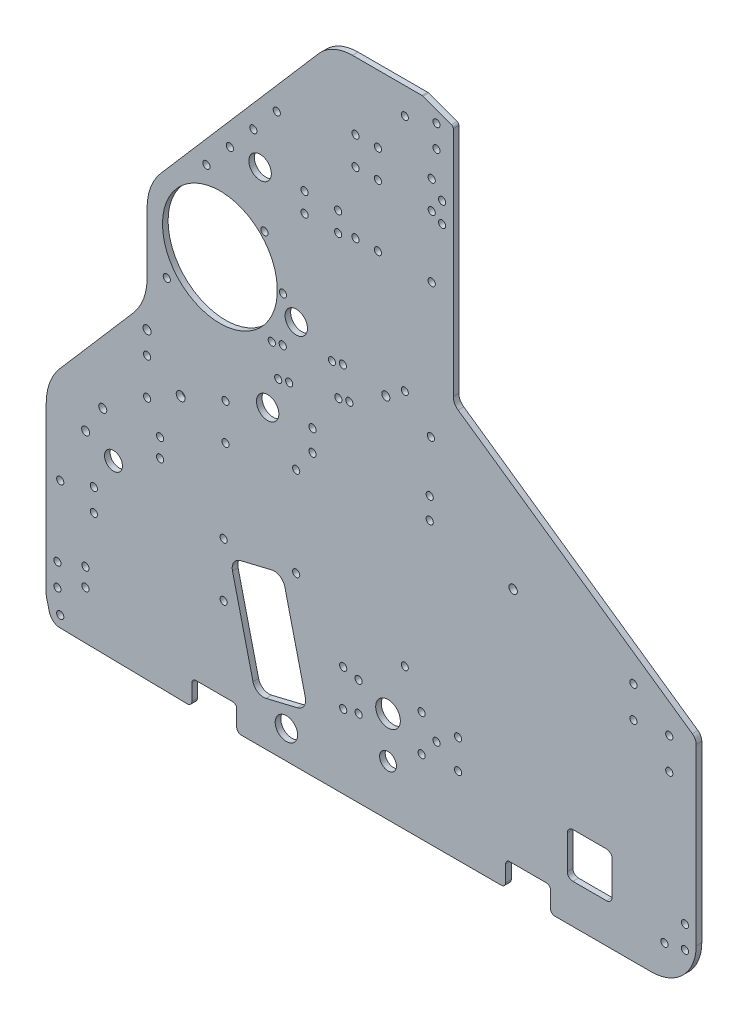
from build123d import *

# Parameters (mm, degrees)
SKETCH1_R           = 2.032
SKETCH1_R_2         = 5.08
SKETCH1_R_3         = 2.54
SKETCH1_R_4         = 6.35
SKETCH1_R_5         = 2
BOSS_EXTRUDE1_DEPTH = 3.175
FILLET1_R           = 2.286
FILLET2_R           = 6.35
SKETCH2_R           = 2.032
CUT_EXTRUDE1_DEPTH  = 505.524983177
FILLET3_R           = 1.5875
SKETCH3_R           = 6.35
SKETCH3_R_2         = 2.032
SKETCH3_R_3         = 2.286
CUT_EXTRUDE2_DEPTH  = 505.524983177
SKETCH4_R           = 2.032
SKETCH4_R_2         = 6.985
SKETCH4_R_3         = 4.7625
CUT_EXTRUDE3_DEPTH  = 505.524983177
SKETCH5_R           = 32.54375
SKETCH5_R_2         = 6.35
SKETCH5_R_3         = 2.39
CUT_EXTRUDE5_DEPTH  = 505.524983177
FILLET4_R           = 31.75
CUT_EXTRUDE6_DEPTH  = 505.524983177
FILLET5_R           = 25.4
SKETCH8_R           = 2.032000002
SKETCH8_R_2         = 2.031999999
SKETCH8_R_3         = 2.031999998
CUT_EXTRUDE7_DEPTH  = 505.524983177
SKETCH10_R          = 2.032
CUT_EXTRUDE8_DEPTH  = 505.524983177
SKETCH11_RX         = 2.032
SKETCH11_RY         = 2.031999502
CUT_EXTRUDE9_DEPTH  = 505.524983177
SKETCH12_R          = 2.032
CUT_EXTRUDE10_DEPTH = 505.524983319
SKETCH14_R          = 6.375981846
CUT_EXTRUDE11_DEPTH = 505.524983319
SKETCH15_R          = 2.286
SKETCH15_R_2        = 2.159
CUT_EXTRUDE12_DEPTH = 505.524983319
FILLET7_R           = 5.08
FILLET8_R           = 2.54
SKETCH17_R          = 2.032
CUT_EXTRUDE13_DEPTH = 505.524983319
FILLET9_R           = 25.4


with BuildPart() as part:
    # Sketch1 → Boss-Extrude1 (new body)
    with BuildSketch(Plane.XY):
        with BuildLine():
            Line((7.829508682, -19.049081656), (82.55, -20.32))
            Line((82.55, -20.32), (82.55, -6.35))
            Line((82.55, -6.35), (107.95, -6.35))
            Line((107.95, -6.35), (107.95, -20.32))
            Line((107.95, -20.32), (260.35, -20.32))
            Line((260.35, -20.32), (260.35, -6.35))
            Line((260.35, -6.35), (285.75, -6.35))
            Line((285.75, -6.35), (285.75, -20.32))
            Line((285.75, -20.32), (368.3, -20.32))
            Line((368.3, -20.32), (368.3, 106.68))
            Line((368.3, 106.68), (230.66375, 202.565))
            Line((230.66375, 202.565), (230.66375, 338.455))
            Line((230.66375, 338.455), (213.19998, 344.805))
            Line((213.19998, 344.805), (203.2, 344.805))
            Line((203.2, 344.805), (161.925, 344.805))
            Line((161.925, 344.805), (52.720122664, 218.469945827))
            ThreePointArc((52.720122664, 218.469945827), (52.803835479, 218.142145922), (52.832, 217.805))
            ThreePointArc((52.832, 217.805), (52.095493096, 216.239521914), (50.419872403, 215.808871996))
            Line((50.419872403, 215.808871996), (0, 157.48))
            Line((0, 157.48), (0, 0))
            Line((0, 0), (0, -6.35))
            ThreePointArc((0, -6.35), (0.047577015, -7.125863724), (0.189595124, -7.890101219))
            Line((0.189595124, -7.890101219), (1.777095124, -14.240101219))
            ThreePointArc((1.777095124, -14.240101219), (3.987212552, -17.671692778), (7.829508682, -19.049081656))
        make_face()
        with Locations((7.9375, -12.7)):
            Circle(SKETCH1_R, mode=Mode.SUBTRACT)
        with Locations((6.35, 0)):
            Circle(SKETCH1_R, mode=Mode.SUBTRACT)
        with Locations((6.35, 12.7)):
            Circle(SKETCH1_R, mode=Mode.SUBTRACT)
        with Locations((38.1, 78.105)):
            Circle(SKETCH1_R_2, mode=Mode.SUBTRACT)
        with Locations((57.15, 118.58625)):
            Circle(SKETCH1_R, mode=Mode.SUBTRACT)
        with Locations((57.15, 139.22375)):
            Circle(SKETCH1_R, mode=Mode.SUBTRACT)
        with Locations((76.2, 128.905)):
            Circle(SKETCH1_R_3, mode=Mode.SUBTRACT)
        with Locations((101.6, 118.58625)):
            Circle(SKETCH1_R, mode=Mode.SUBTRACT)
        with Locations((101.6, 139.22375)):
            Circle(SKETCH1_R, mode=Mode.SUBTRACT)
        with Locations((125.468192568, 147.91106164)):
            Circle(SKETCH1_R_4, mode=Mode.SUBTRACT)
        with Locations((203.2, 59.805)):
            Circle(SKETCH1_R_5, mode=Mode.SUBTRACT)
        with Locations((350.339487758, -2.359487758)):
            Circle(SKETCH1_R, mode=Mode.SUBTRACT)
        with Locations((361.95, 0)):
            Circle(SKETCH1_R, mode=Mode.SUBTRACT)
        with Locations((361.95, 12.7)):
            Circle(SKETCH1_R, mode=Mode.SUBTRACT)
        with Locations((353.06, 82.955052336)):
            Circle(SKETCH1_R, mode=Mode.SUBTRACT)
        with Locations((332.74, 98.195052336)):
            Circle(SKETCH1_R, mode=Mode.SUBTRACT)
        with Locations((332.74, 115.975052336)):
            Circle(SKETCH1_R, mode=Mode.SUBTRACT)
        with Locations((353.06, 100.735052336)):
            Circle(SKETCH1_R, mode=Mode.SUBTRACT)
        with Locations((68.326, 182.923674932)):
            Circle(SKETCH1_R, mode=Mode.SUBTRACT)
        with Locations((76.2, 217.805)):
            Circle(SKETCH1_R, mode=Mode.SUBTRACT)
        with Locations((90.779500502, 249.682)):
            Circle(SKETCH1_R, mode=Mode.SUBTRACT)
        with Locations((104.067838673, 265.054783374)):
            Circle(SKETCH1_R, mode=Mode.SUBTRACT)
        with Locations((117.356176844, 280.427566748)):
            Circle(SKETCH1_R, mode=Mode.SUBTRACT)
        with Locations((130.644515014, 295.800350122)):
            Circle(SKETCH1_R, mode=Mode.SUBTRACT)
        with Locations((203.2, 194.805)):
            Circle(SKETCH1_R_5, mode=Mode.SUBTRACT)
        with Locations((224.31375, 287.401)):
            Circle(SKETCH1_R, mode=Mode.SUBTRACT)
        with Locations((224.31375, 298.831)):
            Circle(SKETCH1_R, mode=Mode.SUBTRACT)
        with Locations((203.2, 329.805)):
            Circle(SKETCH1_R_5, mode=Mode.SUBTRACT)
        with Locations((221.138115, 322.58)):
            Circle(SKETCH1_R_5, mode=Mode.SUBTRACT)
        with Locations((221.138115, 335.28)):
            Circle(SKETCH1_R_5, mode=Mode.SUBTRACT)
    extrude(amount=BOSS_EXTRUDE1_DEPTH)

    # Fillet1
    fillet1_edges = [part.edges().sort_by_distance(p)[0] for p in [
        (285.75, -6.35, 1.5875),
        (107.95, -6.35, 1.5875),
        (260.35, -6.35, 1.5875),
        (82.55, -6.35, 1.5875),
    ]]
    fillet(fillet1_edges, radius=FILLET1_R)

    # Fillet2
    fillet2_edges = [part.edges().sort_by_distance(p)[0] for p in [
        (230.66375, 202.565, 1.5875),
    ]]
    fillet(fillet2_edges, radius=FILLET2_R)

    # Sketch2 → Cut-Extrude1 (cut, through all)
    with BuildSketch(Plane(origin=(0, 0, 0), x_dir=(-1, 0, 0), z_dir=(0, 0, -1))):
        with Locations((-100.552770272, 71.086035298)):
            Circle(SKETCH2_R)
        with Locations((-100.552770272, 40.606035298)):
            Circle(SKETCH2_R)
        with Locations((-22.225, 18.202541089)):
            Circle(SKETCH2_R)
        with Locations((-22.225, 8.042541089)):
            Circle(SKETCH2_R)
    extrude(amount=-CUT_EXTRUDE1_DEPTH, mode=Mode.SUBTRACT)

    # Fillet3
    fillet3_edges = [part.edges().sort_by_distance(p)[0] for p in [
        (230.66375, 338.455, 1.5875),
        (213.19998, 344.805, 1.5875),
    ]]
    fillet(fillet3_edges, radius=FILLET3_R)

    # Sketch3 → Cut-Extrude2 (cut, through all)
    with BuildSketch(Plane.XY.offset(3.175)):
        with BuildLine():
            Line((127.789350211, 69.359774106), (110.090750339, 65.117184968))
            ThreePointArc((110.090750339, 65.117184968), (106.287939856, 62.356288953), (105.55119507, 57.715047577))
            Line((105.55119507, 57.715047577), (117.160037875, 9.287010566))
            ThreePointArc((117.160037875, 9.287010566), (119.92093389, 5.484200083), (124.562175266, 4.747455297))
            Line((124.562175266, 4.747455297), (142.260775137, 8.990044434))
            ThreePointArc((142.260775137, 8.990044434), (146.063585621, 11.75094045), (146.800330407, 16.392181825))
            Line((146.800330407, 16.392181825), (135.191487602, 64.820218836))
            ThreePointArc((135.191487602, 64.820218836), (132.430591586, 68.62302932), (127.789350211, 69.359774106))
        make_face()
        with Locations((136.094563167, -4.324155877)):
            Circle(SKETCH3_R)
        with Locations((26.987500002, 46.953113935)):
            Circle(SKETCH3_R_2)
        with Locations((26.987500002, 59.653113935)):
            Circle(SKETCH3_R_2)
        with Locations((7.937500002, 53.303113935)):
            Circle(SKETCH3_R_2)
        with Locations((32.030600949, 100.810868853)):
            Circle(SKETCH3_R_3)
        with Locations((64.525942114, 102.94048958)):
            Circle(SKETCH3_R_2)
        with Locations((64.525942114, 92.525786339)):
            Circle(SKETCH3_R_2)
        with Locations((134.14375, 208.228121768)):
            Circle(SKETCH3_R_2)
        with Locations((123.681970341, 233.485092108)):
            Circle(SKETCH3_R_2)
    extrude(amount=-CUT_EXTRUDE2_DEPTH, mode=Mode.SUBTRACT)

    # Sketch4 → Cut-Extrude3 (cut, through all)
    with BuildSketch(Plane.XY.offset(3.175)):
        with Locations((168.275, 42.06875)):
            Circle(SKETCH4_R)
        with Locations((212.725, 42.06875)):
            Circle(SKETCH4_R)
        with Locations((212.725, 21.43125)):
            Circle(SKETCH4_R)
        with Locations((168.275, 21.43125)):
            Circle(SKETCH4_R)
        with Locations((193.675, 31.75)):
            Circle(SKETCH4_R_2)
        with Locations((177.00498, 40.0431)):
            Circle(SKETCH4_R)
        with Locations((177.00498, 23.4569)):
            Circle(SKETCH4_R)
        with Locations((193.675, 8.466666658)):
            Circle(SKETCH4_R_3)
        with Locations((221.138115, 31.75)):
            Circle(SKETCH4_R)
        with Locations((233.36123, 23.4569)):
            Circle(SKETCH4_R)
        with Locations((233.36123, 40.0431)):
            Circle(SKETCH4_R)
    extrude(amount=-CUT_EXTRUDE3_DEPTH, mode=Mode.SUBTRACT)

    # Sketch5 → Cut-Extrude5 (cut, through all)
    with BuildSketch(Plane(origin=(0, 0, 0), x_dir=(-1, 0, 0), z_dir=(0, 0, -1))):
        Polygon((0, 157.48), (-57.15, 223.594705882), (-57.15, 165.333696112), (0, 99.218990229), align=None)
        with Locations((-98.425, 208.228121768)):
            Circle(SKETCH5_R)
        with Locations((-141.675587431, 197.971943782)):
            Circle(SKETCH5_R_2)
        with Locations((-264.573581764, 128.332790468)):
            Circle(SKETCH5_R_3)
    extrude(amount=-CUT_EXTRUDE5_DEPTH, mode=Mode.SUBTRACT)

    # Fillet4
    fillet4_edges = [part.edges().sort_by_distance(p)[0] for p in [
        (0, 99.218990229, 1.5875),
        (57.15, 165.333696112, 1.5875),
        (57.15, 223.594705882, 1.5875),
    ]]
    fillet(fillet4_edges, radius=FILLET4_R)

    # Sketch6 → Cut-Extrude6 (cut, through all)
    with BuildSketch(Plane.XY.offset(3.175)):
        with BuildLine():
            Line((298.45, 27.305), (317.5, 27.305))
            ThreePointArc((317.5, 27.305), (319.74506403, 26.37506403), (320.675, 24.13))
            Line((320.675, 24.13), (320.675, 5.08))
            ThreePointArc((320.675, 5.08), (319.74506403, 2.83493597), (317.5, 1.905))
            Line((317.5, 1.905), (298.45, 1.905))
            ThreePointArc((298.45, 1.905), (296.20493597, 2.83493597), (295.275, 5.08))
            Line((295.275, 5.08), (295.275, 24.13))
            ThreePointArc((295.275, 24.13), (296.20493597, 26.37506403), (298.45, 27.305))
        make_face()
    extrude(amount=-CUT_EXTRUDE6_DEPTH, mode=Mode.SUBTRACT)

    # Fillet5
    fillet5_edges = [part.edges().sort_by_distance(p)[0] for p in [
        (161.925, 344.805, 1.5875),
    ]]
    fillet(fillet5_edges, radius=FILLET5_R)

    # Sketch8 → Cut-Extrude7 (cut, through all)
    with BuildSketch(Plane(origin=(0, 0, 0), x_dir=(-1, 0, 0), z_dir=(0, 0, -1))):
        with Locations((-218.44, 290.83)):
            Circle(SKETCH8_R)
        with Locations((-187.96, 290.83)):
            Circle(SKETCH8_R)
        with Locations((-187.96, 306.70500001)):
            Circle(SKETCH8_R_2)
        with Locations((-175.26, 290.83)):
            Circle(SKETCH8_R)
        with Locations((-187.96, 255.905)):
            Circle(SKETCH8_R)
        with Locations((-218.44, 306.70500001)):
            Circle(SKETCH8_R_3)
        with Locations((-175.26, 306.70500001)):
            Circle(SKETCH8_R_2)
        with Locations((-175.26, 255.905)):
            Circle(SKETCH8_R)
        with Locations((-218.44, 255.905)):
            Circle(SKETCH8_R)
    extrude(amount=-CUT_EXTRUDE7_DEPTH, mode=Mode.SUBTRACT)

    # Sketch10 → Cut-Extrude8 (cut, through all)
    with BuildSketch(Plane.XY.offset(3.175)):
        with Locations((141.64248, 74.684371768)):
            Circle(SKETCH10_R)
        with Locations((141.64248, 125.484371768)):
            Circle(SKETCH10_R)
    extrude(amount=-CUT_EXTRUDE8_DEPTH, mode=Mode.SUBTRACT)

    # Sketch11 → Cut-Extrude9 (cut, through all)
    with BuildSketch(Plane.XY.offset(3.175)):
        with Locations(Location((150.881424454, 138.43), (0, 0, 90))):
            Ellipse(SKETCH11_RX, SKETCH11_RY)
        with Locations(Location((150.881424454, 150.495), (0, 0, 90))):
            Ellipse(SKETCH11_RX, SKETCH11_RY)
        with Locations(Location((217.30240818, 150.495), (0, 0, 90))):
            Ellipse(SKETCH11_RX, SKETCH11_RY)
        with Locations(Location((217.30240818, 138.43), (0, 0, 90))):
            Ellipse(SKETCH11_RX, SKETCH11_RY)
    extrude(amount=-CUT_EXTRUDE9_DEPTH, mode=Mode.SUBTRACT)

    # Sketch12 → Cut-Extrude10 (cut, through all)
    with BuildSketch(Plane(origin=(0, 0, 0), x_dir=(-1, 0, 0), z_dir=(0, 0, -1))):
        with Locations((-165.4175, 264.63498)):
            Circle(SKETCH12_R)
        with Locations((-165.4175, 253.52248)):
            Circle(SKETCH12_R)
        with Locations((-146.3675, 253.52248)):
            Circle(SKETCH12_R)
        with Locations((-146.3675, 264.63498)):
            Circle(SKETCH12_R)
    extrude(amount=-CUT_EXTRUDE10_DEPTH, mode=Mode.SUBTRACT)

    # Sketch14 → Cut-Extrude11 (cut, through all)
    with BuildSketch(Plane(origin=(0, 0, 0), x_dir=(-1, 0, 0), z_dir=(0, 0, -1))):
        with Locations((-121.184716432, 263.688494682)):
            Circle(SKETCH14_R)
    extrude(amount=-CUT_EXTRUDE11_DEPTH, mode=Mode.SUBTRACT)

    # Sketch15 → Cut-Extrude12 (cut, through all)
    with BuildSketch(Plane.XY.offset(3.175)):
        with Locations((57.150008088, 151.92375)):
            Circle(SKETCH15_R)
        with Locations((192.439047044, 187.119947783)):
            Circle(SKETCH15_R)
        with Locations((38.099991912, 78.105)):
            Circle(SKETCH15_R_2)
        with Locations((22.359439439, 84.872674248)):
            Circle(SKETCH15_R)
        with BuildLine():
            ThreePointArc((163.873733826, 173.680575348), (163.573165596, 172.102507308), (164.512493295, 170.799317578))
            ThreePointArc((164.512493295, 170.799317578), (167.540832569, 172.982117899), (163.873733826, 173.680575348))
        make_face()
        with BuildLine():
            ThreePointArc((173.439743984, 172.778441408), (173.740312214, 174.356509448), (172.800984515, 175.659699178))
            ThreePointArc((172.800984515, 175.659699178), (169.772645241, 173.476898857), (173.439743984, 172.778441408))
        make_face()
        with BuildLine():
            ThreePointArc((169.158846911, 192.088320238), (166.130507637, 189.905519917), (169.797606381, 189.207062468))
            ThreePointArc((169.797606381, 189.207062468), (170.09817461, 190.785130508), (169.158846911, 192.088320238))
        make_face()
        with BuildLine():
            ThreePointArc((160.231596222, 190.109196408), (159.931027992, 188.531128368), (160.870355691, 187.227938638))
            ThreePointArc((160.870355691, 187.227938638), (163.898694965, 189.410738959), (160.231596222, 190.109196408))
        make_face()
        with BuildLine():
            ThreePointArc((129.776595777, 166.121421832), (129.476027547, 164.543353791), (130.415355246, 163.240164061))
            ThreePointArc((130.415355246, 163.240164061), (133.44369452, 165.422964383), (129.776595777, 166.121421832))
        make_face()
        with BuildLine():
            ThreePointArc((139.342605935, 165.219287891), (139.643174165, 166.797355931), (138.703846466, 168.100545661))
            ThreePointArc((138.703846466, 168.100545661), (135.675507192, 165.91774534), (139.342605935, 165.219287891))
        make_face()
        with BuildLine():
            ThreePointArc((135.700468332, 181.647908951), (136.001036562, 183.225976991), (135.061708862, 184.529166721))
            ThreePointArc((135.061708862, 184.529166721), (132.033369589, 182.3463664), (135.700468332, 181.647908951))
        make_face()
        with BuildLine():
            ThreePointArc((126.134458173, 182.550042891), (125.833889944, 180.971974851), (126.773217643, 179.668785121))
            ThreePointArc((126.773217643, 179.668785121), (129.801556917, 181.851585442), (126.134458173, 182.550042891))
        make_face()
    extrude(amount=-CUT_EXTRUDE12_DEPTH, mode=Mode.SUBTRACT)

    # Fillet7
    fillet7_edges = [part.edges().sort_by_distance(p)[0] for p in [
        (368.3, 106.68, 1.5875),
    ]]
    fillet(fillet7_edges, radius=FILLET7_R)

    # Fillet8
    fillet8_edges = [part.edges().sort_by_distance(p)[0] for p in [
        (82.55, -20.32, 1.5875),
        (107.95, -20.32, 1.5875),
        (260.35, -20.32, 1.5875),
        (285.75, -20.32, 1.5875),
    ]]
    fillet(fillet8_edges, radius=FILLET8_R)

    # Sketch17 → Cut-Extrude13 (cut, through all)
    with BuildSketch(Plane.XY.offset(3.175)):
        with Locations((217.96375, 179.705)):
            Circle(SKETCH17_R)
    extrude(amount=-CUT_EXTRUDE13_DEPTH, mode=Mode.SUBTRACT)

    # Fillet9
    fillet9_edges = [part.edges().sort_by_distance(p)[0] for p in [
        (368.3, -20.32, 1.5875),
    ]]
    fillet(fillet9_edges, radius=FILLET9_R)


solid = part.part
